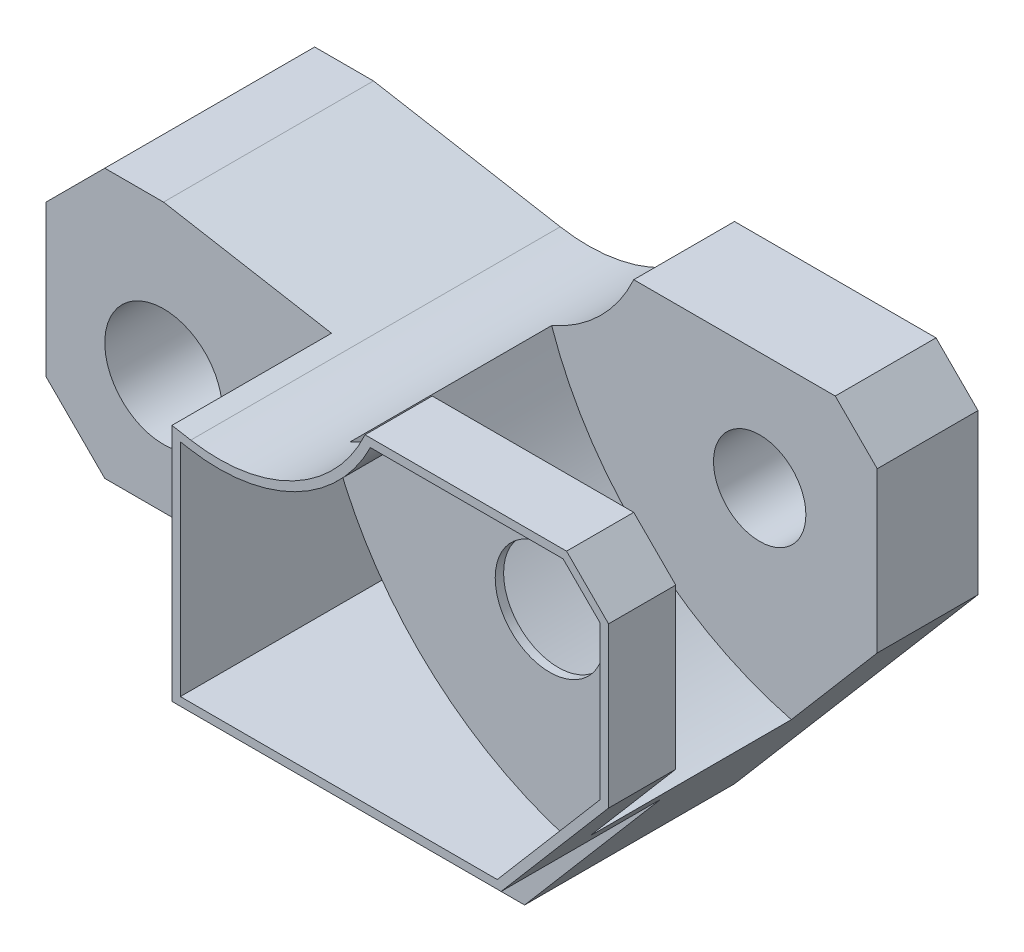
from build123d import *

# Parameters (mm, degrees)
ESQUISSE2_R             = 7
BOSS_EXTRU_2_DEPTH      = 22
ENL_V_MAT_EXTRU_1_DEPTH = 19
ESQUISSE5_R             = 5.5
ENL_V_MAT_EXTRU_2_DEPTH = 105.177732746
ENL_V_START             = -36
ENL_V_MAT_EXTRU_3_DEPTH = 24
COQUE1_START            = 3
COQUE1_DEPTH            = 19
COQUE1_START_2          = 15
COQUE1_2_OUTLINE_R      = 6.5
COQUE1_2_DEPTH          = 7
ENL_V_MAT_EXTRU_4_REACH = 106.178
ESQUISSE16_R            = 6.5
ENL_V_START_2           = -13
ENL_V_MAT_EXTRU_5_DEPTH = 13


# Read off the part's stored shape, not the designer's step: Coque1
with BuildPart() as part:
    # Esquisse2 → Boss.-Extru.2 (new, symmetric)
    with BuildSketch(Plane.XY):
        with BuildLine():
            Line((51.296980053, -19), (57, -19))
            Line((57, -19), (86, 15))
            Line((86, 15), (86, 34))
            Line((86, 34), (81, 39))
            Line((81, 39), (57, 39))
            ThreePointArc((57, 39), (48.490791592, 29.99016727), (36.246410316, 28.077357637))
            Line((36.246410316, 28.077357637), (14, 32))
            Line((14, 32), (7, 32))
            Line((7, 32), (0, 25))
            Line((0, 25), (0, 7))
            Line((0, 7), (7, 0))
            Line((7, 0), (39.575538911, 0))
            ThreePointArc((39.575538911, 0), (42.840774692, -1.213413768), (44.521177653, -4.264705882))
            ThreePointArc((44.521177653, -4.264705882), (46.858007856, -12.115672061), (51.296980053, -19))
        make_face()
        with Locations((14, 14)):
            Circle(ESQUISSE2_R, mode=Mode.SUBTRACT)
    extrude(amount=BOSS_EXTRU_2_DEPTH, both=True)

    # Esquisse4 → Enlèv. mat.-Extru.1 (cut)
    with BuildSketch(Plane.XY.offset(22)):
        Polygon((34, 32), (0, 32), (0, -19), (86, -19), (86, 0), (34, 0), align=None)
    extrude(amount=-ENL_V_MAT_EXTRU_1_DEPTH, mode=Mode.SUBTRACT)

    # Esquisse5 → Enlèv. mat.-Extru.2 (cut, through all)
    with BuildSketch(Plane.XY.offset(22)):
        with Locations((72, 25)):
            Circle(ESQUISSE5_R)
    extrude(amount=-ENL_V_MAT_EXTRU_2_DEPTH, mode=Mode.SUBTRACT)

    # Esquisse14 → Enlèv. mat.-Extru.3 (cut)
    with BuildSketch(Plane(origin=(0, 0, -22), x_dir=(-1, 0, 0), z_dir=(0, 0, -1)).offset(ENL_V_START)):
        with BuildLine():
            Line((-75.764705882, 3), (-86, 15))
            Line((-86, 15), (-86, 34))
            Line((-86, 34), (-81, 39))
            Line((-81, 39), (-57, 39))
            ThreePointArc((-57, 39), (-53.002548038, 33.285750119), (-47.224051208, 29.381745985))
            ThreePointArc((-47.224051208, 29.381745985), (-58.169717695, 12.59414375), (-75.764705882, 3))
        make_face()
    extrude(amount=ENL_V_MAT_EXTRU_3_DEPTH, mode=Mode.SUBTRACT)

    # Coque1 outline → Coque1 (cut)
    with BuildSketch(Plane.XY.offset(COQUE1_START)):
        with BuildLine():
            Line((72.744476296, 1), (73.986847747, 2.456573425))
            ThreePointArc((73.986847747, 2.456573425), (57.296143365, 12.041008897), (46.63326541, 28.064243583))
            ThreePointArc((46.63326541, 28.064243583), (41.418086005, 26.871182604), (36.072762138, 27.092549884))
            Line((36.072762138, 27.092549884), (35, 27.281706793))
            Line((35, 27.281706793), (35, 1))
            Line((35, 1), (72.744476296, 1))
        make_face()
    extrude(amount=COQUE1_DEPTH, mode=Mode.SUBTRACT)

    # Coque1 2 outline → Coque1 2 (cut)
    with BuildSketch(Plane.XY.offset(COQUE1_START_2)):
        with BuildLine():
            Line((73.986847747, 2.456573425), (85, 15.368545033))
            Line((85, 15.368545033), (85, 33.585786438))
            Line((85, 33.585786438), (80.585786438, 38))
            Line((80.585786438, 38), (57.631958739, 38))
            ThreePointArc((57.631958739, 38), (53.079347815, 31.984103338), (46.63326541, 28.064243583))
            ThreePointArc((46.63326541, 28.064243583), (57.296143365, 12.041008897), (73.986847747, 2.456573425))
        make_face()
        with Locations((72, 25)):
            Circle(COQUE1_2_OUTLINE_R, mode=Mode.SUBTRACT)
    extrude(amount=COQUE1_2_DEPTH, mode=Mode.SUBTRACT)

    # Esquisse16 → Enlèv. mat.-Extru.4 (cut, up to next)
    with BuildSketch(Plane.XY.offset(22), mode=Mode.PRIVATE) as enl_v_mat_extru_4_sk1:
        with Locations(Location((72, 25, 0), (0, 0, 180))):
            Circle(ESQUISSE16_R)
    enl_v_mat_extru_4_tool1 = extrude(enl_v_mat_extru_4_sk1.sketch, amount=-ENL_V_MAT_EXTRU_4_REACH, mode=Mode.PRIVATE) & part.part
    add(enl_v_mat_extru_4_tool1.solids().sort_by_distance((72, 25, 22))[0], mode=Mode.SUBTRACT)

    # Esquisse17 → Enlèv. mat.-Extru.5 (cut)
    with BuildSketch(Plane.XY.offset(3).offset(ENL_V_START_2)):
        with BuildLine():
            Line((72.744476296, 1), (73.986847747, 2.456573425))
            ThreePointArc((73.986847747, 2.456573425), (57.296143365, 12.041008897), (46.63326541, 28.064243583))
            ThreePointArc((46.63326541, 28.064243583), (41.418086005, 26.871182604), (36.072762138, 27.092549884))
            Line((36.072762138, 27.092549884), (35, 27.281706793))
            Line((35, 27.281706793), (35, 1))
            Line((35, 1), (72.744476296, 1))
        make_face()
    extrude(amount=ENL_V_MAT_EXTRU_5_DEPTH, mode=Mode.SUBTRACT)


solid = part.part
